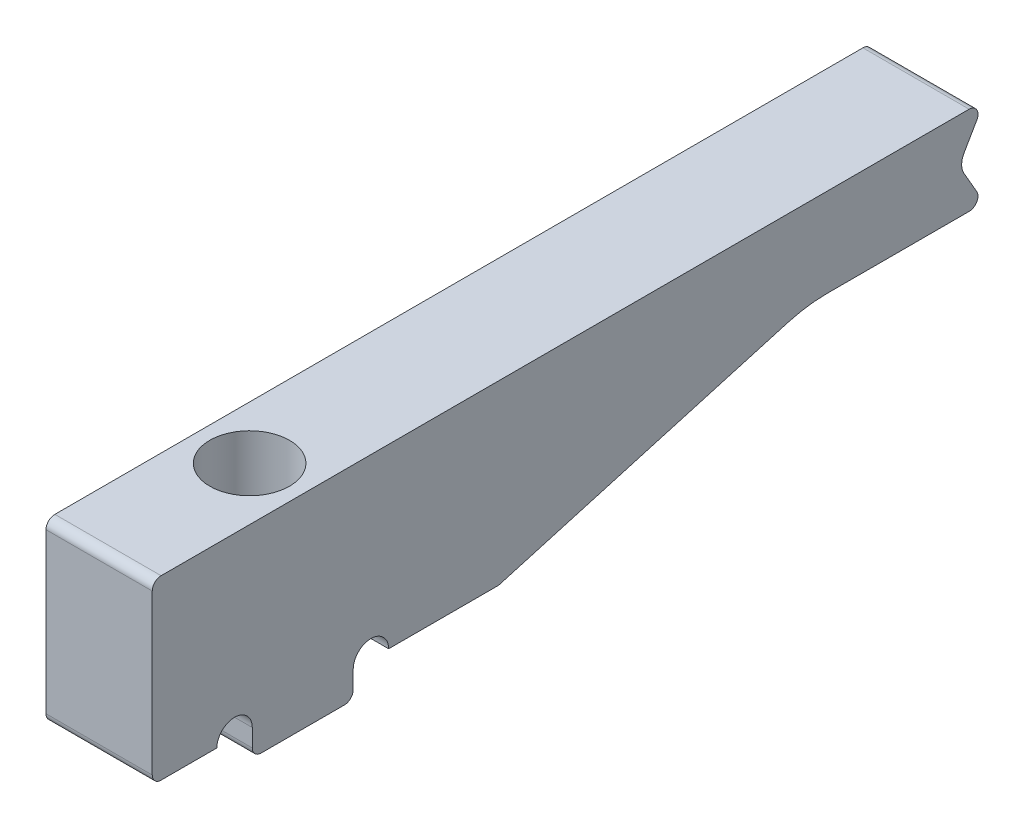
from build123d import *

# Parameters (mm, degrees)
ESQUISSE1_W             = 6
ESQUISSE1_H             = 5
BOSS_EXTRU_1_DEPTH      = 8.5
ESQUISSE5_W             = 6
ESQUISSE5_H             = 5
BOSS_EXTRU_3_DEPTH      = 30
ENL_V_MAT_EXTRU_2_DEPTH = 40.044846011
ESQUISSE7_W             = 6
ESQUISSE7_H             = 17
BOSS_EXTRU_4_DEPTH      = 5
ESQUISSE2_R             = 2.25
ENL_V_MAT_EXTRU_1_DEPTH = 40.890475054
ESQUISSE9_W             = 6
ESQUISSE9_H             = 5.7
BOSS_EXTRU_6_DEPTH      = 1.5
ENL_V_MAT_EXTRU_3_DEPTH = 40.990623901
CHANFREIN2_SIZE         = 20
CHANFREIN2_SIZE_2       = 5.734907715
CONG_1_R                = 0.5
CONG_2_R                = 1
CONG_3_R                = 8


with BuildPart() as part:
    # Esquisse1 → Boss.-Extru.1 (new, symmetric)
    with BuildSketch(Plane.XY):
        Rectangle(ESQUISSE1_W, ESQUISSE1_H)
    extrude(amount=BOSS_EXTRU_1_DEPTH, both=True)

    # Esquisse5 → Boss.-Extru.3 (add)
    with BuildSketch(Plane(origin=(-2.5, 0, -8.5), x_dir=(1, 0, 0), z_dir=(0, 0, 1))):
        with Locations((2.5, 0)):
            Rectangle(ESQUISSE5_W, ESQUISSE5_H)
    extrude(amount=-BOSS_EXTRU_3_DEPTH)

    # Esquisse6 → Enlèv. mat.-Extru.2 (cut, through all)
    with BuildSketch(Plane(origin=(3, 0, 0), x_dir=(0, 0, -1), z_dir=(1, 0, 0))):
        Polygon((38.5, 2.5), (37.056624327, 0), (38.5, -2.5), align=None)
    extrude(amount=-ENL_V_MAT_EXTRU_2_DEPTH, mode=Mode.SUBTRACT)

    # Esquisse7 → Boss.-Extru.4 (add)
    with BuildSketch(Plane.XZ.offset(2.5)):
        Rectangle(ESQUISSE7_W, ESQUISSE7_H)
    extrude(amount=BOSS_EXTRU_4_DEPTH)

    # Esquisse2 → Enlèv. mat.-Extru.1 (cut, through all)
    with BuildSketch(Plane(origin=(0, 2.5, 0), x_dir=(1, 0, 0), z_dir=(0, 1, 0))):
        with Locations(Location((0, 0, 0), (0, 0, 270))):
            Circle(ESQUISSE2_R)
    extrude(amount=-ENL_V_MAT_EXTRU_1_DEPTH, mode=Mode.SUBTRACT)

    # Esquisse9 → Boss.-Extru.6 (add)
    with BuildSketch(Plane.XZ.offset(7.5)):
        Rectangle(ESQUISSE9_W, ESQUISSE9_H)
    extrude(amount=BOSS_EXTRU_6_DEPTH)

    # Esquisse10 → Enlèv. mat.-Extru.3 (cut, through all)
    with BuildSketch(Plane(origin=(3, 0, 0), x_dir=(0, 0, -1), z_dir=(1, 0, 0))):
        with BuildLine():
            Line((-4.85, -7.5), (-2.85, -7.5))
            ThreePointArc((-2.85, -7.5), (-3.85, -6.5), (-4.85, -7.5))
        make_face()
        with BuildLine():
            Line((4.85, -7.5), (2.85, -7.5))
            ThreePointArc((2.85, -7.5), (3.85, -6.5), (4.85, -7.5))
        make_face()
    extrude(amount=-ENL_V_MAT_EXTRU_3_DEPTH, mode=Mode.SUBTRACT)

    # Chanfrein2
    # the kernel refuses this chamfer: 20, 5.734907715 mm, written as the material it adds along each edge
    with BuildSketch(Plane(origin=(3, -2.5, -8.5), x_dir=(0, 0.010616657410321303, -0.9999436417045873), z_dir=(-1, 0, 0))) as chanfrein2_piece_1_section:
        Polygon((CHANFREIN2_SIZE * 0.999943641705, CHANFREIN2_SIZE * 0.0106166574103), (-CHANFREIN2_SIZE_2 * 0.0106166574106, CHANFREIN2_SIZE_2 * 0.999943641735), (0, 0), align=None)
    chanfrein2_piece_1 = extrude(amount=6, mode=Mode.PRIVATE)
    chanfrein2_piece_1 = split(chanfrein2_piece_1, bisect_by=Plane(origin=(0, -7.5, -15.61390523), z_dir=(0, 1, 0)), keep=Keep.TOP, mode=Mode.PRIVATE)
    add(chanfrein2_piece_1)

    # Congé1
    cong_1_edges = [part.edges().sort_by_distance(p)[0] for p in [
        (0, -2.5, -38.5),
        (0, 2.5, -38.5),
        (0, -7.5, 8.5),
        (0, -9, 2.85),
        (0, -9, -2.85),
        (0, 2.5, 8.5),
        (0, -7.5, -11.062927781),
    ]]
    fillet(cong_1_edges, radius=CONG_1_R)

    # Congé2
    cong_2_edges = [part.edges().sort_by_distance(p)[0] for p in [
        (0, 0, -37.056624327),
    ]]
    fillet(cong_2_edges, radius=CONG_2_R)

    # Congé3
    cong_3_edges = [part.edges().sort_by_distance(p)[0] for p in [
        (0, -2.5, -28.5),
    ]]
    fillet(cong_3_edges, radius=CONG_3_R)


solid = part.part
